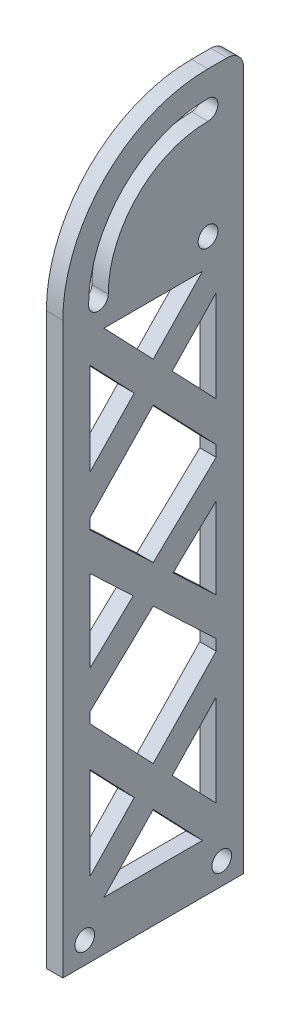
from build123d import *

# Parameters (mm, degrees)
SKETCH1_R            = 1.5
BOSS_EXTRUDE1_DEPTH  = 3
M3_CLEARANCE_HOLE1_D = 3.6
CUT_EXTRUDE1_DEPTH   = 10


with BuildPart() as part:
    # Sketch1 → Boss-Extrude1 (new body)
    with BuildSketch(Plane(origin=(0, 0, 0), x_dir=(0, 0, -1), z_dir=(1, 0, 0))):
        with BuildLine():
            Line((33, 103.968745116), (33, 127.468745116))
            ThreePointArc((33, 127.468745116), (32.121320344, 129.590065459), (30, 130.468745116))
            Line((30, 130.468745116), (26.5, 130.468745116))
            ThreePointArc((26.5, 130.468745116), (7.761670299, 122.707074817), (0, 103.968745116))
            Line((0, 103.968745116), (0, 0))
            Line((0, 0), (33, 0))
            Line((33, 0), (33, 103.968745116))
        make_face()
        with Locations((4, 4)):
            Circle(SKETCH1_R, mode=Mode.SUBTRACT)
        with Locations((29, 4)):
            Circle(SKETCH1_R, mode=Mode.SUBTRACT)
        with Locations((26.5, 103.968745116)):
            Circle(SKETCH1_R, mode=Mode.SUBTRACT)
        with BuildLine():
            ThreePointArc((4.7, 103.968745116), (11.08507217, 119.383672946), (26.5, 125.768745116))
            ThreePointArc((26.5, 125.768745116), (28.3, 123.968745116), (26.5, 122.168745116))
            ThreePointArc((26.5, 122.168745116), (13.630656582, 116.838088533), (8.3, 103.968745116))
            ThreePointArc((8.3, 103.968745116), (6.5, 102.168745116), (4.7, 103.968745116))
        make_face(mode=Mode.SUBTRACT)
    extrude(amount=BOSS_EXTRUDE1_DEPTH)

    # M3 Clearance Hole1 (through all)
    with Locations(Plane.ZY):
        with Locations((-29, 4), (-4, 4), (-26.5, 103.968745116)):
            Hole(M3_CLEARANCE_HOLE1_D / 2)

    # Sketch4 → Cut-Extrude1 (cut)
    with BuildSketch(Plane(origin=(3, 0, 0), x_dir=(0, 0, -1), z_dir=(1, 0, 0))):
        Polygon((7.5, 9), (25.5, 9), (16.5, 18.405683521), align=None)
        Polygon((5, 13.619501596), (13.039872779, 22.021779252), (5, 30.424056909), align=None)
        Polygon((28, 30.424056909), (19.960127221, 22.021779252), (28, 13.619501596), align=None)
        Polygon((5, 37.656248372), (16.5, 25.637874984), (28, 37.656248372), (28, 39.656248372), (16.5, 50.541969576), (5, 39.656248372), align=None)
        Polygon((5, 61.427690781), (5, 46.541054335), (12.863342994, 53.984372558), align=None)
        Polygon((20.136657006, 53.984372558), (28, 46.541054335), (28, 61.427690781), align=None)
        Polygon((5, 70.312496744), (5, 68.312496744), (16.5, 57.426775539), (28, 68.312496744), (28, 70.312496744), (16.5, 82.330870131), align=None)
        Polygon((5, 94.349243519), (5, 77.544688207), (13.039872779, 85.946965863), align=None)
        Polygon((19.960127221, 85.946965863), (28, 77.544688207), (28, 94.349243519), align=None)
        Polygon((7.5, 98.968745116), (16.5, 89.563061595), (25.5, 98.968745116), align=None)
    extrude(amount=-CUT_EXTRUDE1_DEPTH, mode=Mode.SUBTRACT)


solid = part.part
